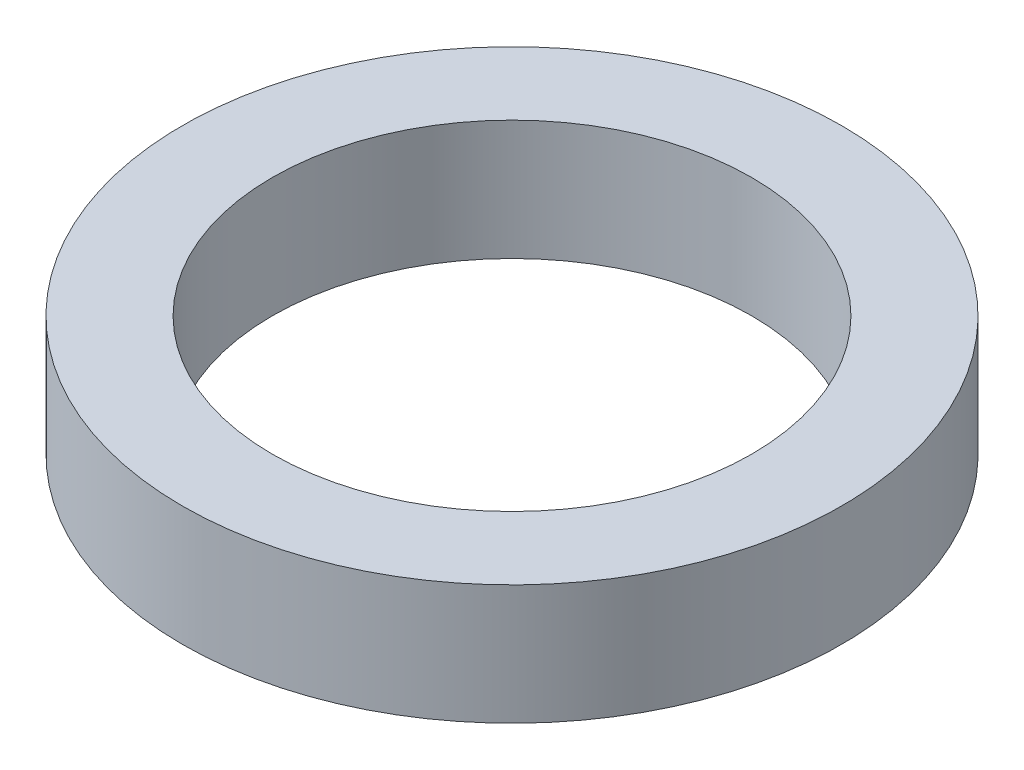
from build123d import *

# Parameters (mm, degrees)
SKETCH1_R           = 27.5
BOSS_EXTRUDE1_DEPTH = 10
SKETCH2_R           = 20
CUT_EXTRUDE1_DEPTH  = 41.155946011


with BuildPart() as part:
    # Sketch1 → Boss-Extrude1 (new body)
    with BuildSketch(Plane(origin=(0, 0, 0), x_dir=(1, 0, 0), z_dir=(0, 1, 0))):
        Circle(SKETCH1_R)
    extrude(amount=BOSS_EXTRUDE1_DEPTH)

    # Sketch2 → Cut-Extrude1 (cut, through all)
    with BuildSketch(Plane(origin=(0, 0, 0), x_dir=(1, 0, 0), z_dir=(0, 1, 0))):
        Circle(SKETCH2_R)
    extrude(amount=CUT_EXTRUDE1_DEPTH, mode=Mode.SUBTRACT)


solid = part.part
